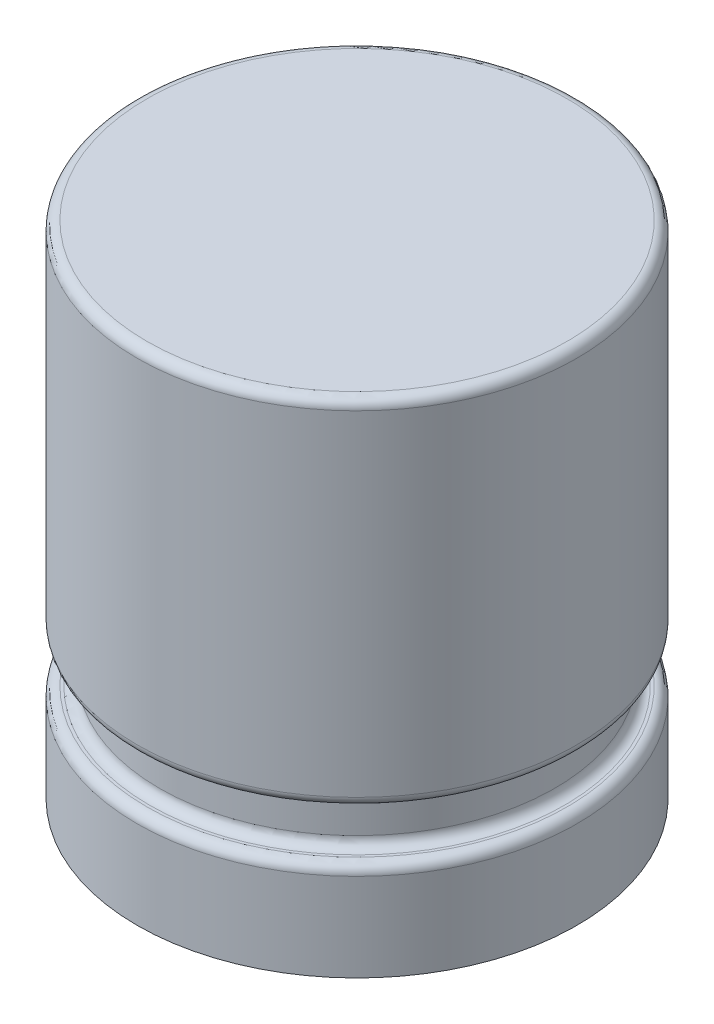
from build123d import *

# Parameters (mm, degrees)
CROQUIS1_R              = 1.8
SALIENTE_EXTRUIR1_DEPTH = 0.8
CROQUIS2_R              = 1.617310407
SALIENTE_EXTRUIR2_DEPTH = 0.4
CROQUIS3_R              = 1.8
SALIENTE_EXTRUIR3_DEPTH = 2.9
REDONDEO3_R             = 0.08
REDONDEO4_R             = 0.08


with BuildPart() as part:
    # Croquis1 → Saliente-Extruir1 (new body)
    with BuildSketch(Plane(origin=(0, 0, 0), x_dir=(1, 0, 0), z_dir=(0, 1, 0))):
        Circle(CROQUIS1_R)
    extrude(amount=SALIENTE_EXTRUIR1_DEPTH)

    # Croquis2 → Saliente-Extruir2 (add)
    with BuildSketch(Plane(origin=(0, 0.8, 0), x_dir=(1, 0, 0), z_dir=(0, 1, 0))):
        Circle(CROQUIS2_R)
    extrude(amount=SALIENTE_EXTRUIR2_DEPTH)

    # Croquis3 → Saliente-Extruir3 (add)
    with BuildSketch(Plane(origin=(0, 1.2, 0), x_dir=(1, 0, 0), z_dir=(0, 1, 0))):
        Circle(CROQUIS3_R)
    extrude(amount=SALIENTE_EXTRUIR3_DEPTH)

    # Redondeo3
    redondeo3_edges = [part.edges().sort_by_distance(p)[0] for p in [
        (-1.8, 0.8, 0),
        (-1.617310407, 0.8, 0),
        (-1.8, 1.2, 0),
        (-1.617310407, 1.2, 0),
    ]]
    fillet(redondeo3_edges, radius=REDONDEO3_R)

    # Redondeo4
    redondeo4_edges = [part.edges().sort_by_distance(p)[0] for p in [
        (-1.8, 4.1, 0),
    ]]
    fillet(redondeo4_edges, radius=REDONDEO4_R)


solid = part.part
